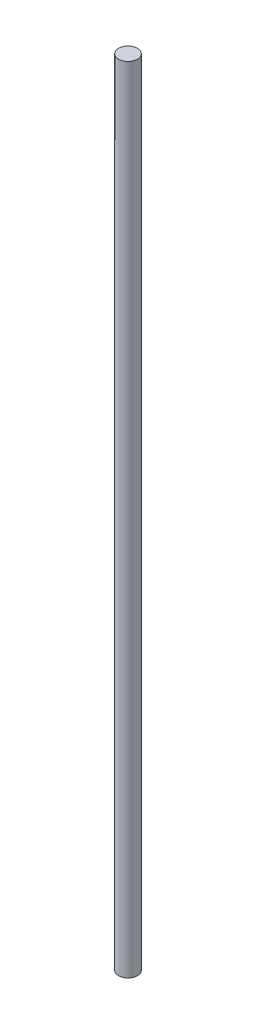
from build123d import *

# Parameters (mm, degrees)
SKETCH2_R           = 5
BOSS_EXTRUDE1_DEPTH = 420


with BuildPart() as part:
    # Sketch2 → Boss-Extrude1 (new body)
    with BuildSketch(Plane(origin=(0, 0, 0), x_dir=(1, 0, 0), z_dir=(0, 1, 0))):
        Circle(SKETCH2_R)
    extrude(amount=BOSS_EXTRUDE1_DEPTH)


solid = part.part
